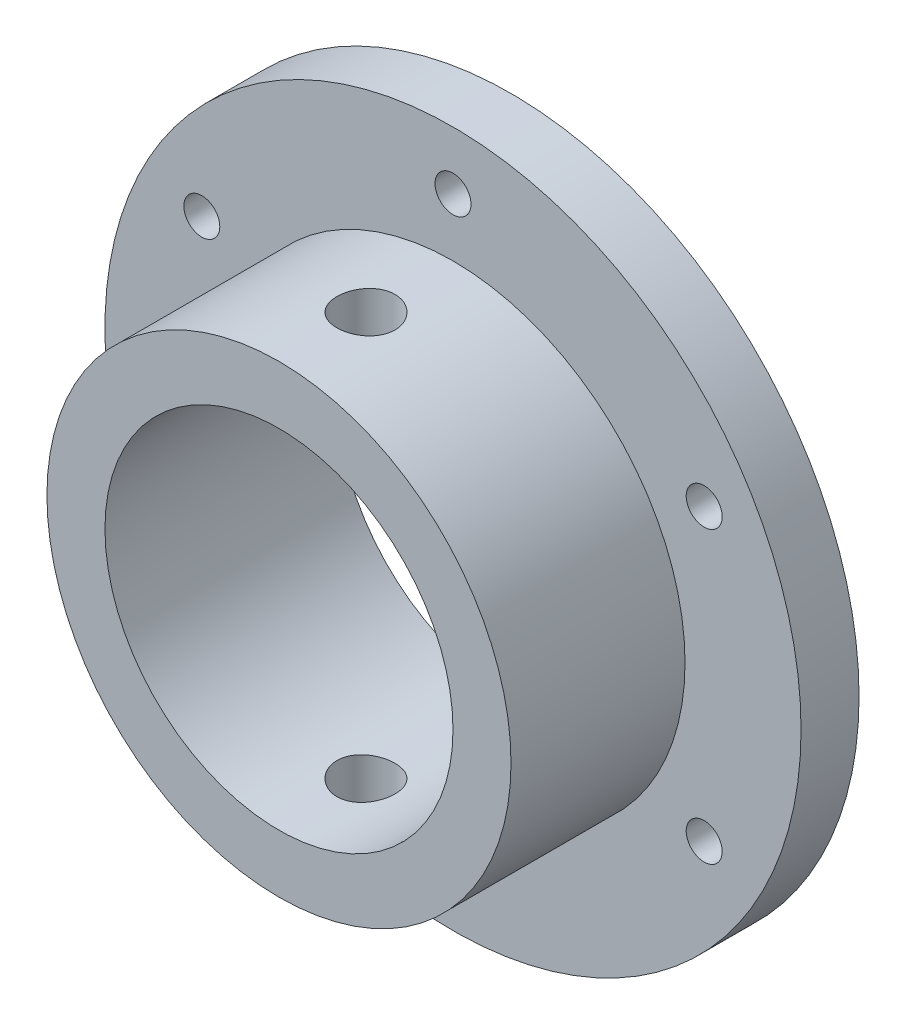
from build123d import *

# Parameters (mm, degrees)
SKETCH1_R               = 30
BOSS_EXTRUDE1_DEPTH     = 5
SKETCH2_R               = 20
SKETCH2_R_2             = 15
BOSS_EXTRUDE2_DEPTH     = 15
CUT_EXTRUDE1_START      = -20
SKETCH3_R               = 15
CUT_EXTRUDE1_DEPTH      = 20
CUT_EXTRUDE3_DEPTH      = 47.904157598
CUT_EXTRUDE3_DEPTH_BACK = 47.904157598
SKETCH5_R               = 2.5
SKETCH6_R               = 1.55
CUT_EXTRUDE4_DEPTH      = 10


with BuildPart() as part:
    # Sketch1 → Boss-Extrude1 (new body)
    with BuildSketch(Plane.XY):
        Circle(SKETCH1_R)
    extrude(amount=BOSS_EXTRUDE1_DEPTH)

    # Sketch2 → Boss-Extrude2 (add)
    with BuildSketch(Plane.XY.offset(5)):
        Circle(SKETCH2_R)
        Circle(SKETCH2_R_2, mode=Mode.SUBTRACT)
    extrude(amount=BOSS_EXTRUDE2_DEPTH)

    # Sketch3 → Cut-Extrude1 (cut)
    with BuildSketch(Plane.XY.offset(5).offset(CUT_EXTRUDE1_START)):
        Circle(SKETCH3_R)
    extrude(amount=CUT_EXTRUDE1_DEPTH, mode=Mode.SUBTRACT)

    # Sketch5 → Cut-Extrude3 (cut, two sides: drawn at the far end of the back side and taken through both)
    with BuildSketch(Plane(origin=(0, 0, 0), x_dir=(1, 0, 0), z_dir=(0, 1, 0)).offset(-CUT_EXTRUDE3_DEPTH_BACK)):
        with Locations((0, -12.5)):
            Circle(SKETCH5_R)
    extrude(amount=CUT_EXTRUDE3_DEPTH + CUT_EXTRUDE3_DEPTH_BACK, mode=Mode.SUBTRACT)

    # Sketch6 → Cut-Extrude4 (cut)
    with BuildSketch(Plane.XY.offset(5)):
        with Locations((0, 25)):
            Circle(SKETCH6_R)
        with Locations((21.650635095, 12.5)):
            Circle(SKETCH6_R)
        with Locations((21.650635095, -12.5)):
            Circle(SKETCH6_R)
        with Locations((0, -25)):
            Circle(SKETCH6_R)
        with Locations((-21.650635095, -12.5)):
            Circle(SKETCH6_R)
        with Locations((-21.650635095, 12.5)):
            Circle(SKETCH6_R)
    extrude(amount=-CUT_EXTRUDE4_DEPTH, mode=Mode.SUBTRACT)


solid = part.part
